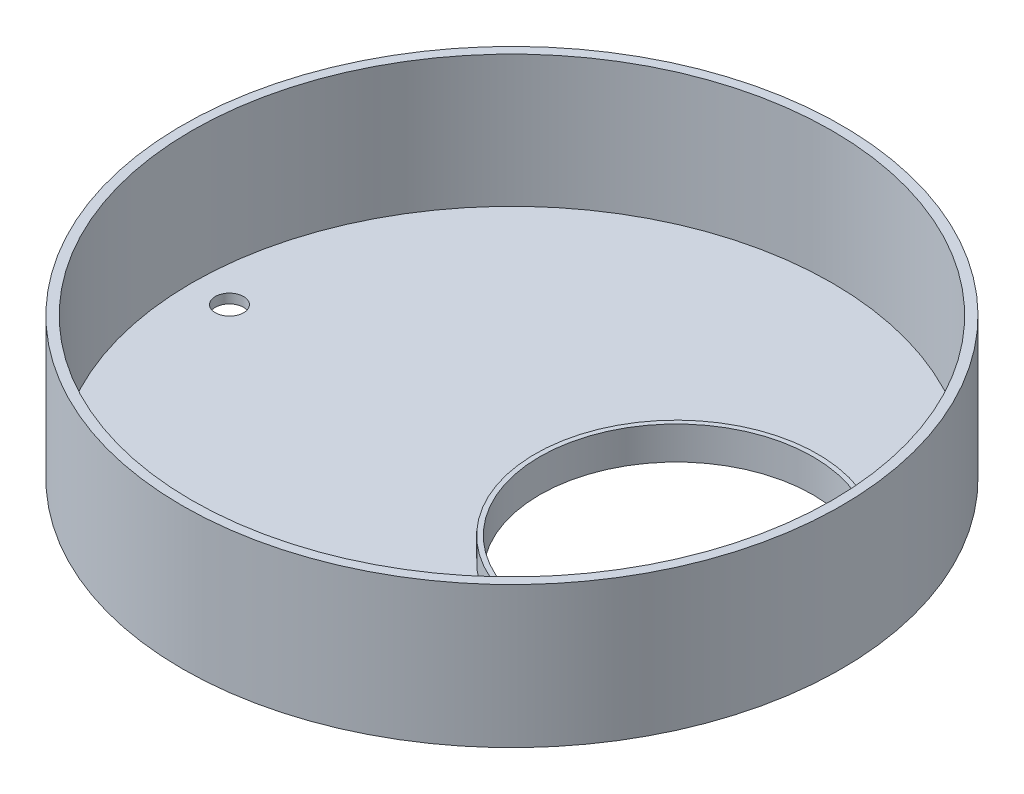
from build123d import *

# Parameters (mm, degrees)
SKETCH1_R           = 70
BOSS_EXTRUDE1_DEPTH = 30
SHELL1_T            = -2
SKETCH2_R           = 33
SKETCH2_R_2         = 29
EXTRUDE_THIN1_DEPTH = 5
CUT_EXTRUDE1_START  = -5
SKETCH3_R           = 33
SKETCH3_R_2         = 30
CUT_EXTRUDE1_DEPTH  = 5
CUT_EXTRUDE2_START  = -2
SKETCH4_R           = 29
CUT_EXTRUDE2_DEPTH  = 2
SKETCH5_R           = 3
CUT_EXTRUDE3_DEPTH  = 5


with BuildPart() as part:
    # Sketch1 → Boss-Extrude1 (new body)
    with BuildSketch(Plane(origin=(0, 0, 0), x_dir=(1, 0, 0), z_dir=(0, 1, 0))):
        Circle(SKETCH1_R)
    extrude(amount=BOSS_EXTRUDE1_DEPTH)

    # Shell1
    shell1_openings = [part.faces().sort_by_distance(p)[0] for p in [
        (0, 30, 0),
    ]]
    offset(amount=SHELL1_T, openings=shell1_openings, kind=Kind.INTERSECTION)

    # Sketch2 → Extrude-Thin1 (add)
    with BuildSketch(Plane(origin=(0, 2, 0), x_dir=(1, 0, 0), z_dir=(0, 1, 0))):
        with Locations((34.921312676, 0)):
            Circle(SKETCH2_R)
        with Locations((34.921312676, 0)):
            Circle(SKETCH2_R_2, mode=Mode.SUBTRACT)
    extrude(amount=EXTRUDE_THIN1_DEPTH)

    # Sketch3 → Cut-Extrude1 (cut)
    with BuildSketch(Plane(origin=(0, 7, 0), x_dir=(1, 0, 0), z_dir=(0, 1, 0)).offset(CUT_EXTRUDE1_START)):
        with Locations((34.921312676, 0)):
            Circle(SKETCH3_R)
        with Locations((34.921312676, 0)):
            Circle(SKETCH3_R_2, mode=Mode.SUBTRACT)
    extrude(amount=CUT_EXTRUDE1_DEPTH, mode=Mode.SUBTRACT)

    # Sketch4 → Cut-Extrude2 (cut)
    with BuildSketch(Plane(origin=(0, 2, 0), x_dir=(1, 0, 0), z_dir=(0, 1, 0)).offset(CUT_EXTRUDE2_START)):
        with Locations((34.921312676, 0)):
            Circle(SKETCH4_R)
    extrude(amount=CUT_EXTRUDE2_DEPTH, mode=Mode.SUBTRACT)

    # Sketch5 → Cut-Extrude3 (cut, symmetric)
    with BuildSketch(Plane(origin=(0, 2, 0), x_dir=(1, 0, 0), z_dir=(0, 1, 0))):
        with Locations((-60, 0)):
            Circle(SKETCH5_R)
    extrude(amount=CUT_EXTRUDE3_DEPTH, both=True, mode=Mode.SUBTRACT)


solid = part.part
